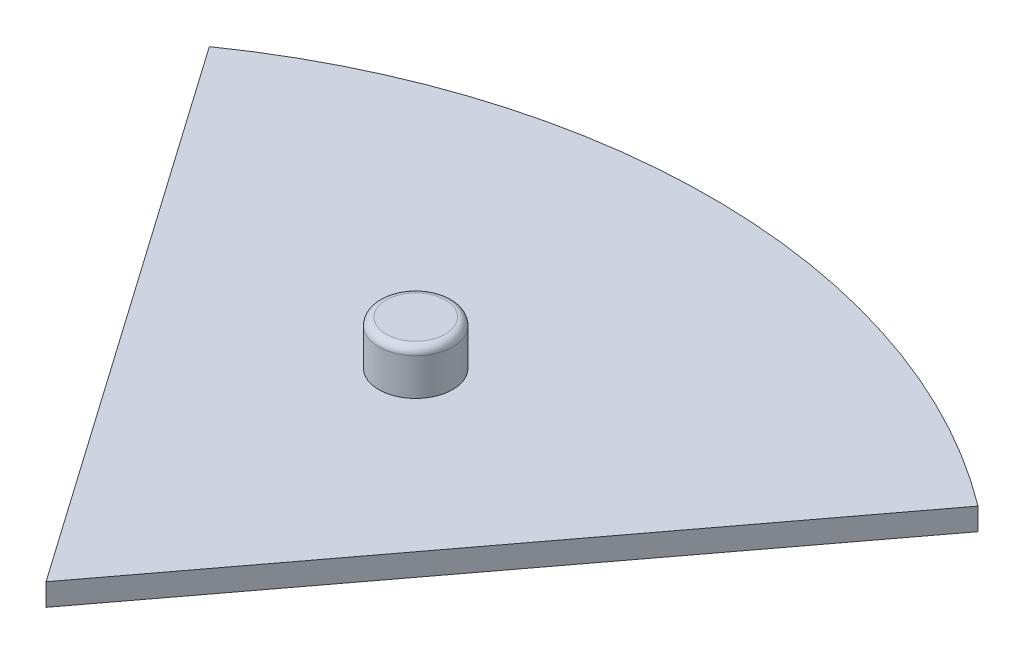
from build123d import *

# Parameters (mm, degrees)
BOSS_EXTRUDE1_DEPTH = 1.5
BOSS_EXTRUDE2_DEPTH = 1.5
BOSS_EXTRUDE3_DEPTH = 3
FILLET1_R           = 0.5


with BuildPart() as part:
    # Sketch2 → Boss-Extrude1 (new body)
    with BuildSketch(Plane(origin=(0, 0, 0), x_dir=(1, 0, 0), z_dir=(0, 1, 0))):
        with BuildLine():
            Line((-25.815069681, 36.858949759), (0, 0))
            Line((0, 0), (27.07764911, 35.94163211))
            ThreePointArc((27.07764911, 35.94163211), (0.780317, 44.993233996), (-25.815069681, 36.858949759))
        make_face()
    extrude(amount=BOSS_EXTRUDE1_DEPTH)

    # Sketch3 → Boss-Extrude2 (add)
    with BuildSketch(Plane.XZ):
        with BuildLine():
            Line((0, -34.375), (10, -34.375))
            ThreePointArc((10, -34.375), (10.625, -35), (10, -35.625))
            Line((10, -35.625), (0, -35.625))
            ThreePointArc((0, -35.625), (-0.625, -35), (0, -34.375))
        make_face()
    extrude(amount=BOSS_EXTRUDE2_DEPTH)

    # Sketch4 → Boss-Extrude3 (add)
    with BuildSketch(Plane(origin=(0, 1.5, 0), x_dir=(1, 0, 0), z_dir=(0, 1, 0))):
        with BuildLine():
            ThreePointArc((0, 22.5), (1.767766953, 23.232233047), (2.5, 25))
            ThreePointArc((2.5, 25), (-1.767766953, 26.767766953), (0, 22.5))
        make_face()
    extrude(amount=BOSS_EXTRUDE3_DEPTH)

    # Fillet1
    fillet1_edges = [part.edges().sort_by_distance(p)[0] for p in [
        (0, 4.5, -27.5),
    ]]
    fillet(fillet1_edges, radius=FILLET1_R)


solid = part.part
